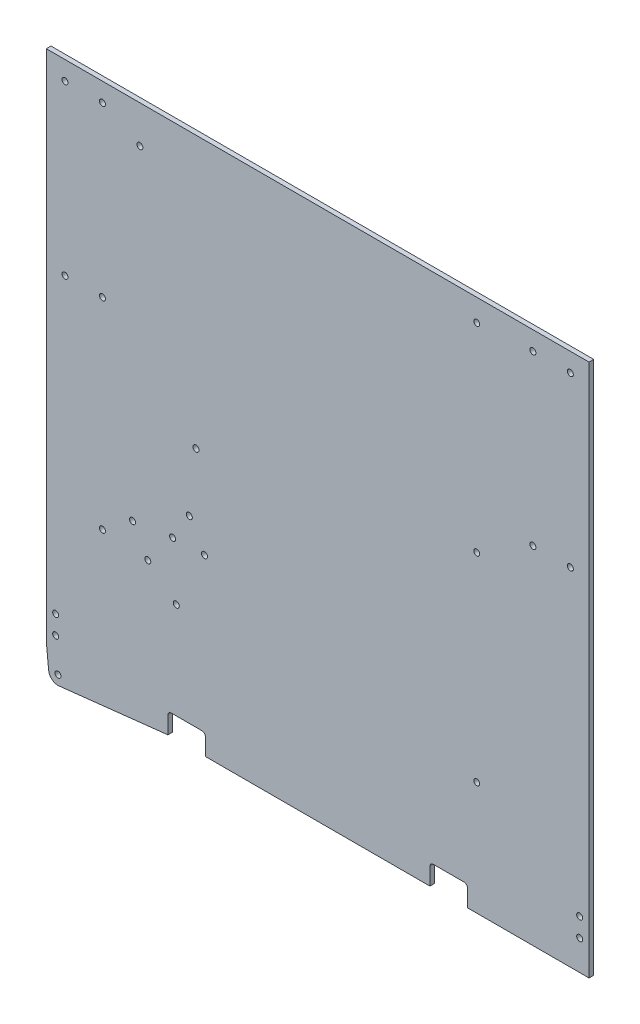
from build123d import *

# Parameters (mm, degrees)
SKETCH1_R           = 2.032
SKETCH1_R_2         = 2
BOSS_EXTRUDE1_DEPTH = 3.175
FILLET1_R           = 2.286


with BuildPart() as part:
    # Sketch1 → Boss-Extrude1 (new body)
    with BuildSketch(Plane.XY):
        with BuildLine():
            Line((82.55, -20.32), (82.55, -6.35))
            Line((82.55, -6.35), (107.95, -6.35))
            Line((107.95, -6.35), (107.95, -20.32))
            Line((107.95, -20.32), (260.35, -20.32))
            Line((260.35, -20.32), (260.35, -6.35))
            Line((260.35, -6.35), (285.75, -6.35))
            Line((285.75, -6.35), (285.75, -20.32))
            Line((285.75, -20.32), (368.3, -20.32))
            Line((368.3, -20.32), (368.3, 341.63))
            Line((368.3, 341.63), (0, 341.63))
            Line((0, 341.63), (0, 0))
            Line((0, 0), (0, -6.35))
            ThreePointArc((0, -6.35), (0.007883354, -6.666317007), (0.031513842, -6.981848616))
            Line((0.031513842, -6.981848616), (1.619013842, -22.856848616))
            ThreePointArc((1.619013842, -22.856848616), (3.943628298, -27.161748811), (8.639060666, -28.536126099))
            Line((8.639060666, -28.536126099), (82.55, -20.32))
        make_face()
        with Locations((6.35, 0)):
            Circle(SKETCH1_R, mode=Mode.SUBTRACT)
        with Locations((6.35, 12.7)):
            Circle(SKETCH1_R, mode=Mode.SUBTRACT)
        with Locations((361.95, 0)):
            Circle(SKETCH1_R, mode=Mode.SUBTRACT)
        with Locations((361.95, 12.7)):
            Circle(SKETCH1_R, mode=Mode.SUBTRACT)
        with Locations((7.9375, -22.225)):
            Circle(SKETCH1_R, mode=Mode.SUBTRACT)
        with Locations((38.1, 78.105)):
            Circle(SKETCH1_R, mode=Mode.SUBTRACT)
        with Locations((85.725, 97.155)):
            Circle(SKETCH1_R, mode=Mode.SUBTRACT)
        with Locations((58.568579744, 93.391299635)):
            Circle(SKETCH1_R, mode=Mode.SUBTRACT)
        with Locations((68.887329744, 75.518700365)):
            Circle(SKETCH1_R, mode=Mode.SUBTRACT)
        with Locations((107.382158942, 97.743700365)):
            Circle(SKETCH1_R, mode=Mode.SUBTRACT)
        with Locations((97.063408942, 115.616299635)):
            Circle(SKETCH1_R, mode=Mode.SUBTRACT)
        with Locations((88.216909404, 59.136578314)):
            Circle(SKETCH1_R, mode=Mode.SUBTRACT)
        with Locations((292.1, 56.63)):
            Circle(SKETCH1_R_2, mode=Mode.SUBTRACT)
        with Locations((292.1, 191.63)):
            Circle(SKETCH1_R_2, mode=Mode.SUBTRACT)
        with Locations((292.1, 326.63)):
            Circle(SKETCH1_R_2, mode=Mode.SUBTRACT)
        with Locations((63.5, 316.23)):
            Circle(SKETCH1_R, mode=Mode.SUBTRACT)
        with Locations((101.6, 157.48)):
            Circle(SKETCH1_R, mode=Mode.SUBTRACT)
        with Locations((355.6, 328.93)):
            Circle(SKETCH1_R, mode=Mode.SUBTRACT)
        with Locations((330.2, 328.93)):
            Circle(SKETCH1_R, mode=Mode.SUBTRACT)
        with Locations((355.6, 214.63)):
            Circle(SKETCH1_R, mode=Mode.SUBTRACT)
        with Locations((330.2, 214.63)):
            Circle(SKETCH1_R, mode=Mode.SUBTRACT)
        with Locations((12.7, 328.93)):
            Circle(SKETCH1_R, mode=Mode.SUBTRACT)
        with Locations((38.1, 328.93)):
            Circle(SKETCH1_R, mode=Mode.SUBTRACT)
        with Locations((12.7, 214.63)):
            Circle(SKETCH1_R, mode=Mode.SUBTRACT)
        with Locations((38.1, 214.63)):
            Circle(SKETCH1_R, mode=Mode.SUBTRACT)
    extrude(amount=BOSS_EXTRUDE1_DEPTH)

    # Fillet1
    fillet1_edges = [part.edges().sort_by_distance(p)[0] for p in [
        (285.75, -6.35, 1.5875),
        (107.95, -6.35, 1.5875),
        (260.35, -6.35, 1.5875),
        (82.55, -6.35, 1.5875),
    ]]
    fillet(fillet1_edges, radius=FILLET1_R)


solid = part.part
